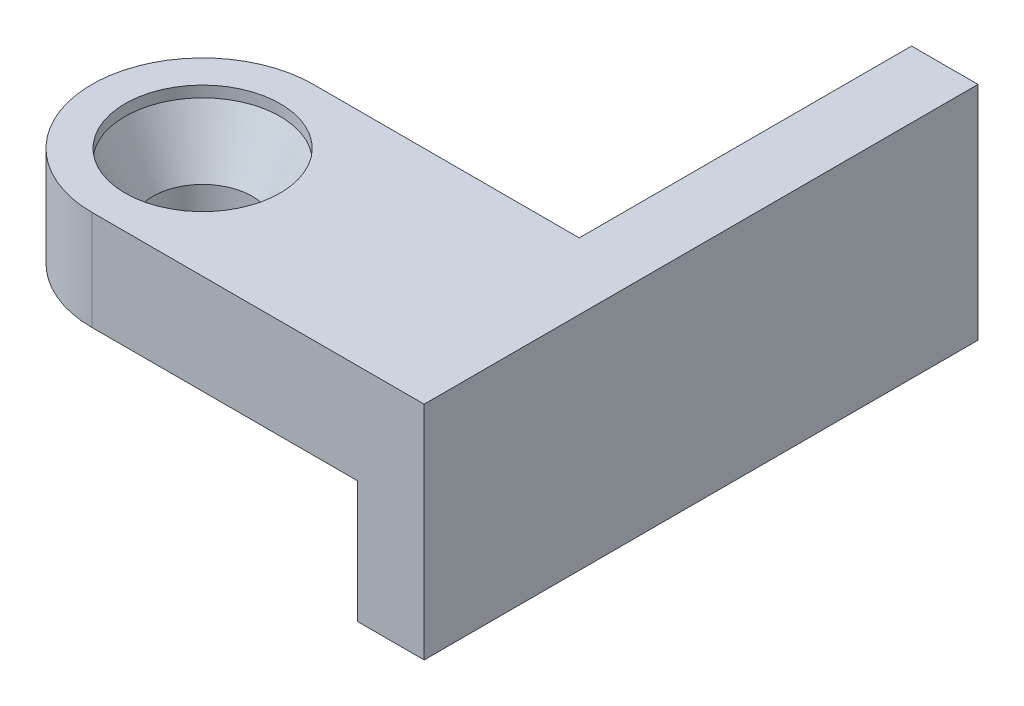
from build123d import *

# Parameters (mm, degrees)
SKETCH1_R           = 2.25
BOSS_EXTRUDE1_DEPTH = 4.5
SKETCH2_W           = 25
SKETCH2_H           = 10
BOSS_EXTRUDE2_DEPTH = 3
SKETCH3_R           = 3.5
CUT_EXTRUDE1_DEPTH  = 3
CHAMFER1_SIZE2      = 1.25
CHAMFER1_SIZE       = 2.5


with BuildPart() as part:
    # Sketch1 → Boss-Extrude1 (new body)
    with BuildSketch(Plane(origin=(0, 0, 0), x_dir=(1, 0, 0), z_dir=(0, 1, 0))):
        with BuildLine():
            Line((0, 5), (15, 5))
            Line((15, 5), (15, -5))
            Line((15, -5), (0, -5))
            ThreePointArc((0, -5), (-5, 0), (0, 5))
        make_face()
        with Locations(Location((0, 0, 0), (0, 0, 270))):
            Circle(SKETCH1_R, mode=Mode.SUBTRACT)
    extrude(amount=BOSS_EXTRUDE1_DEPTH)

    # Sketch2 → Boss-Extrude2 (add)
    with BuildSketch(Plane(origin=(15, 0, 0), x_dir=(0, 0, -1), z_dir=(1, 0, 0))):
        with Locations((7.5, -0.5)):
            Rectangle(SKETCH2_W, SKETCH2_H)
    extrude(amount=-BOSS_EXTRUDE2_DEPTH)

    # Sketch3 → Cut-Extrude1 (cut)
    with BuildSketch(Plane(origin=(0, 4.5, 0), x_dir=(1, 0, 0), z_dir=(0, 1, 0))):
        with Locations(Location((0, 0, 0), (0, 0, 270))):
            Circle(SKETCH3_R)
    extrude(amount=-CUT_EXTRUDE1_DEPTH, mode=Mode.SUBTRACT)

    # Chamfer1
    chamfer1_edges = [part.edges().sort_by_distance(p)[0] for p in [
        (0, 1.5, -3.5),
    ]]
    chamfer1_side = [part.faces().sort_by_distance(p)[0] for p in [
        (0, 1.525, -3.5),
    ]]
    chamfer(chamfer1_edges, length=CHAMFER1_SIZE - 0.0001, length2=CHAMFER1_SIZE2 - 0.0001, reference=chamfer1_side[0])  # a hair under: the kernel refuses the full size


solid = part.part
